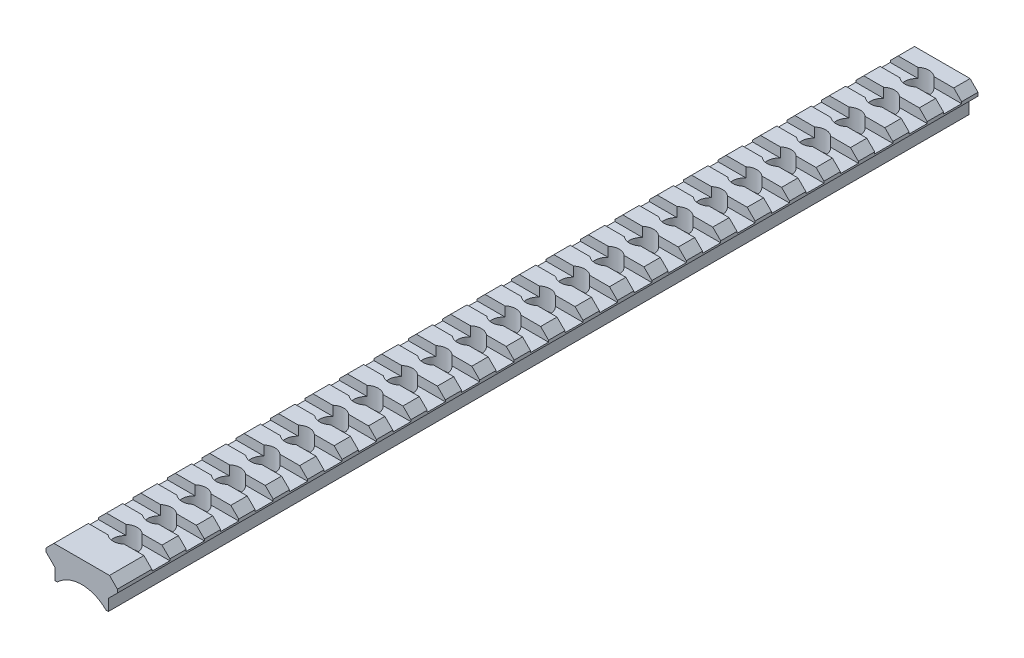
from build123d import *

# Parameters (mm, degrees)
DODANIE_WYCI_GNI_CIE2_DEPTH     = 250
SZKIC2_W                        = 21.74
SZKIC2_H                        = 5.25
WYTNIJ_WYCI_GNI_CIE2_DEPTH      = 2.8
SZKIC3_R                        = 1.75
WYTNIJ_WYCI_GNI_CIE3_DEPTH      = 252.046743855
WYTNIJ_WYCI_GNI_CIE4_DEPTH      = 3.2
WYTNIJ_WYCI_GNI_CIE4_DEPTH_BACK = 253.899045471
SZKIC4_R                        = 3.5
CUT_EXTRUDE1_DEPTH              = 252.046743855
SKETCH2_R                       = 10
CUT_EXTRUDE2_DEPTH              = 252.003939411
SKETCH3_W                       = 15.5
SKETCH3_H                       = 0.75
CUT_EXTRUDE3_DEPTH              = 252.003939514


with BuildPart() as part:
    # Szkic1 → Dodanie-wyciągnięcie2 (new body)
    with BuildSketch(Plane.XY):
        Polygon((2.8, 2.8), (0, 0), (3.12, -3.12), (3.12, -7.2), (18.62, -7.2), (18.62, -3.12), (21.74, 0), (18.94, 2.8), align=None)
    extrude(amount=DODANIE_WYCI_GNI_CIE2_DEPTH)

    # Szkic2 → Wytnij-wyciągnięcie2 (cut)
    with BuildSketch(Plane(origin=(0, 2.8, 0), x_dir=(1, 0, 0), z_dir=(0, 1, 0))):
        with Locations((10.87, -17.375)):
            Rectangle(SZKIC2_W, SZKIC2_H)
        with Locations((10.87, -7.375)):
            Rectangle(SZKIC2_W, SZKIC2_H)
        with Locations((10.87, -27.375)):
            Rectangle(SZKIC2_W, SZKIC2_H)
        with Locations((10.87, -37.375)):
            Rectangle(SZKIC2_W, SZKIC2_H)
        with Locations((10.87, -47.375)):
            Rectangle(SZKIC2_W, SZKIC2_H)
        with Locations((10.87, -57.375)):
            Rectangle(SZKIC2_W, SZKIC2_H)
        with Locations((10.87, -67.375)):
            Rectangle(SZKIC2_W, SZKIC2_H)
        with Locations((10.87, -77.375)):
            Rectangle(SZKIC2_W, SZKIC2_H)
        with Locations((10.87, -87.375)):
            Rectangle(SZKIC2_W, SZKIC2_H)
        with Locations((10.87, -97.375)):
            Rectangle(SZKIC2_W, SZKIC2_H)
        with Locations((10.87, -107.375)):
            Rectangle(SZKIC2_W, SZKIC2_H)
        with Locations((10.87, -117.375)):
            Rectangle(SZKIC2_W, SZKIC2_H)
        with Locations((10.87, -127.375)):
            Rectangle(SZKIC2_W, SZKIC2_H)
        with Locations((10.87, -137.375)):
            Rectangle(SZKIC2_W, SZKIC2_H)
        with Locations((10.87, -147.375)):
            Rectangle(SZKIC2_W, SZKIC2_H)
        with Locations((10.87, -157.375)):
            Rectangle(SZKIC2_W, SZKIC2_H)
        with Locations((10.87, -167.375)):
            Rectangle(SZKIC2_W, SZKIC2_H)
        with Locations((10.87, -177.375)):
            Rectangle(SZKIC2_W, SZKIC2_H)
        with Locations((10.87, -187.375)):
            Rectangle(SZKIC2_W, SZKIC2_H)
        with Locations((10.87, -197.375)):
            Rectangle(SZKIC2_W, SZKIC2_H)
        with Locations((10.87, -207.375)):
            Rectangle(SZKIC2_W, SZKIC2_H)
        with Locations((10.87, -217.375)):
            Rectangle(SZKIC2_W, SZKIC2_H)
        with Locations((10.87, -227.375)):
            Rectangle(SZKIC2_W, SZKIC2_H)
        with Locations((10.87, -237.375)):
            Rectangle(SZKIC2_W, SZKIC2_H)
    extrude(amount=-WYTNIJ_WYCI_GNI_CIE2_DEPTH, mode=Mode.SUBTRACT)

    # Szkic3 → Wytnij-wyciągnięcie3 (cut, through all)
    with BuildSketch(Plane(origin=(0, 0, 0), x_dir=(1, 0, 0), z_dir=(0, 1, 0))):
        with Locations((10.87, -7.375)):
            Circle(SZKIC3_R)
        with Locations((10.87, -17.375)):
            Circle(SZKIC3_R)
        with Locations((10.87, -27.375)):
            Circle(SZKIC3_R)
        with Locations((10.87, -37.375)):
            Circle(SZKIC3_R)
        with Locations((10.87, -47.375)):
            Circle(SZKIC3_R)
        with Locations((10.87, -57.375)):
            Circle(SZKIC3_R)
        with Locations((10.87, -67.375)):
            Circle(SZKIC3_R)
        with Locations((10.87, -77.375)):
            Circle(SZKIC3_R)
        with Locations((10.87, -87.375)):
            Circle(SZKIC3_R)
        with Locations((10.87, -97.375)):
            Circle(SZKIC3_R)
        with Locations((10.87, -107.375)):
            Circle(SZKIC3_R)
        with Locations((10.87, -117.375)):
            Circle(SZKIC3_R)
        with Locations((10.87, -127.375)):
            Circle(SZKIC3_R)
        with Locations((10.87, -137.375)):
            Circle(SZKIC3_R)
        with Locations((10.87, -147.375)):
            Circle(SZKIC3_R)
        with Locations((10.87, -157.375)):
            Circle(SZKIC3_R)
        with Locations((10.87, -167.375)):
            Circle(SZKIC3_R)
        with Locations((10.87, -177.375)):
            Circle(SZKIC3_R)
        with Locations((10.87, -187.375)):
            Circle(SZKIC3_R)
        with Locations((10.87, -197.375)):
            Circle(SZKIC3_R)
        with Locations((10.87, -207.375)):
            Circle(SZKIC3_R)
        with Locations((10.87, -217.375)):
            Circle(SZKIC3_R)
        with Locations((10.87, -227.375)):
            Circle(SZKIC3_R)
        with Locations((10.87, -237.375)):
            Circle(SZKIC3_R)
    extrude(amount=-WYTNIJ_WYCI_GNI_CIE3_DEPTH, mode=Mode.SUBTRACT)

    # Szkic4 → Wytnij-wyciągnięcie4 (cut, two sides: drawn at the far end of the back side and taken through both)
    with BuildSketch(Plane(origin=(0, 0, -1.86), x_dir=(1, 0, 0), z_dir=(0, -1, 0)).offset(-WYTNIJ_WYCI_GNI_CIE4_DEPTH_BACK)):
        with Locations((10.87, 9.235)):
            Circle(SZKIC4_R)
        with Locations((10.87, 19.235)):
            Circle(SZKIC4_R)
        with Locations((10.87, 29.235)):
            Circle(SZKIC4_R)
        with Locations((10.87, 39.235)):
            Circle(SZKIC4_R)
        with Locations((10.87, 49.235)):
            Circle(SZKIC4_R)
        with Locations((10.87, 59.235)):
            Circle(SZKIC4_R)
        with Locations((10.87, 69.235)):
            Circle(SZKIC4_R)
        with Locations((10.87, 79.235)):
            Circle(SZKIC4_R)
        with Locations((10.87, 89.235)):
            Circle(SZKIC4_R)
        with Locations((10.87, 99.235)):
            Circle(SZKIC4_R)
        with Locations((10.87, 109.235)):
            Circle(SZKIC4_R)
        with Locations((10.87, 119.235)):
            Circle(SZKIC4_R)
        with Locations((10.87, 129.235)):
            Circle(SZKIC4_R)
        with Locations((10.87, 139.235)):
            Circle(SZKIC4_R)
        with Locations((10.87, 149.235)):
            Circle(SZKIC4_R)
        with Locations((10.87, 159.235)):
            Circle(SZKIC4_R)
        with Locations((10.87, 169.235)):
            Circle(SZKIC4_R)
        with Locations((10.87, 179.235)):
            Circle(SZKIC4_R)
        with Locations((10.87, 189.235)):
            Circle(SZKIC4_R)
        with Locations((10.87, 199.235)):
            Circle(SZKIC4_R)
        with Locations((10.87, 209.235)):
            Circle(SZKIC4_R)
        with Locations((10.87, 219.235)):
            Circle(SZKIC4_R)
        with Locations((10.87, 229.235)):
            Circle(SZKIC4_R)
        with Locations((10.87, 239.235)):
            Circle(SZKIC4_R)
    extrude(amount=WYTNIJ_WYCI_GNI_CIE4_DEPTH + WYTNIJ_WYCI_GNI_CIE4_DEPTH_BACK, mode=Mode.SUBTRACT)

    # Sketch1 → Cut-Extrude1 (cut, through all)
    with BuildSketch(Plane.XY.offset(250)):
        Polygon((0.5, 0.5), (0.5, -0.5), (0, 0), align=None)
        Polygon((21.24, 0.5), (21.24, -0.5), (21.74, 0), align=None)
    extrude(amount=-CUT_EXTRUDE1_DEPTH, mode=Mode.SUBTRACT)

    # Sketch2 → Cut-Extrude2 (cut, through all)
    with BuildSketch(Plane(origin=(0, 0, 0), x_dir=(-1, 0, 0), z_dir=(0, 0, -1))):
        with Locations((-10.87, -13.51961233)):
            Circle(SKETCH2_R)
    extrude(amount=-CUT_EXTRUDE2_DEPTH, mode=Mode.SUBTRACT)

    # Sketch3 → Cut-Extrude3 (cut, through all)
    with BuildSketch(Plane.XY.offset(250)):
        with Locations((10.87, -6.825)):
            Rectangle(SKETCH3_W, SKETCH3_H)
    extrude(amount=-CUT_EXTRUDE3_DEPTH, mode=Mode.SUBTRACT)


solid = part.part
